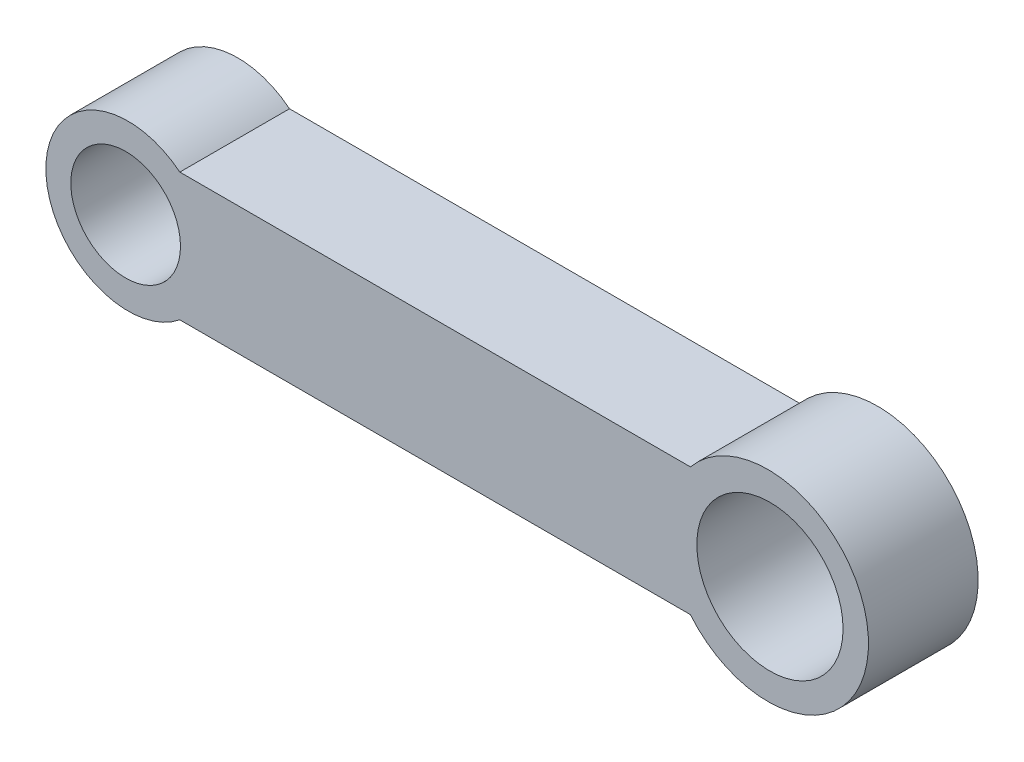
from build123d import *

# Parameters (mm, degrees)
BOSS_EXTRUDE2_DEPTH      = 6
CUT_EXTRUDE1_OUTLINE_R   = 4
CUT_EXTRUDE1_OUTLINE_R_2 = 3
CUT_EXTRUDE1_DEPTH       = 6


# Read off the part's stored shape, not the designer's step: Cut-Extrude1
with BuildPart() as part:
    # Sketch1 → Boss-Extrude2 (new body)
    with BuildSketch(Plane.XY):
        with BuildLine():
            Line((-15.512, -3.5), (-15.512, 3.5))
            Line((-15.512, 3.5), (-14.027572875, 3.5))
            ThreePointArc((-14.027572875, 3.5), (-21.356, 0), (-14.027572875, -3.5))
            Line((-14.027572875, -3.5), (-15.512, -3.5))
        make_face()
        with BuildLine():
            Line((-14.027572875, 3.5), (-15.512, 3.5))
            Line((-15.512, 3.5), (-15.512, -3.5))
            Line((-15.512, -3.5), (-14.027572875, -3.5))
            ThreePointArc((-14.027572875, -3.5), (-12.795339828, -1.939339828), (-12.356, 0))
            ThreePointArc((-12.356, 0), (-12.795339828, 1.939339828), (-14.027572875, 3.5))
        make_face()
        with BuildLine():
            Line((13.901359313, 3.5), (-14.027572875, 3.5))
            ThreePointArc((-14.027572875, 3.5), (-12.795339828, 1.939339828), (-12.356, 0))
            ThreePointArc((-12.356, 0), (-12.795339828, -1.939339828), (-14.027572875, -3.5))
            Line((-14.027572875, -3.5), (13.901359313, -3.5))
            ThreePointArc((13.901359313, -3.5), (12.644, 0), (13.901359313, 3.5))
        make_face()
        with BuildLine():
            ThreePointArc((23.644, 0), (20.003499425, 5.176124215), (13.901359313, 3.5))
            Line((13.901359313, 3.5), (15.512, 3.5))
            Line((15.512, 3.5), (15.512, -3.5))
            Line((15.512, -3.5), (13.901359313, -3.5))
            ThreePointArc((13.901359313, -3.5), (20.003499425, -5.176124215), (23.644, 0))
        make_face()
        with BuildLine():
            Line((15.512, 3.5), (13.901359313, 3.5))
            ThreePointArc((13.901359313, 3.5), (12.644, 0), (13.901359313, -3.5))
            Line((13.901359313, -3.5), (15.512, -3.5))
            Line((15.512, -3.5), (15.512, 3.5))
        make_face()
    extrude(amount=BOSS_EXTRUDE2_DEPTH)

    # Cut-Extrude1 outline → Cut-Extrude1 (cut)
    with BuildSketch(Plane.XY):
        with Locations((18.253573905, 0)):
            Circle(CUT_EXTRUDE1_OUTLINE_R)
        with Locations((-16.991061145, 0)):
            Circle(CUT_EXTRUDE1_OUTLINE_R_2)
    extrude(amount=CUT_EXTRUDE1_DEPTH, mode=Mode.SUBTRACT)


solid = part.part
